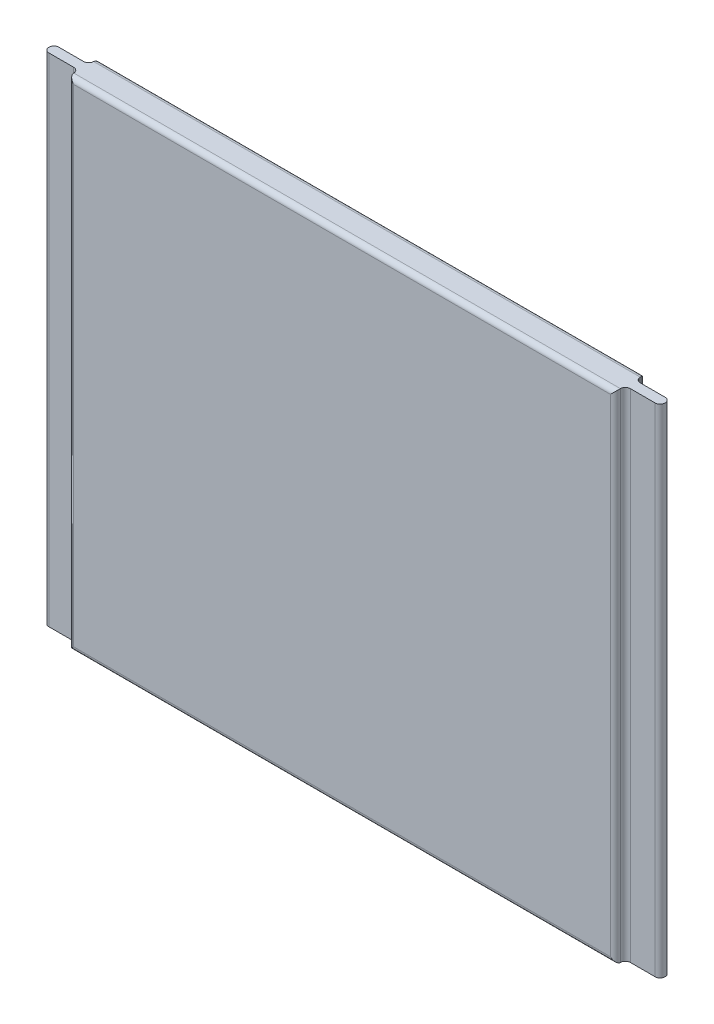
from build123d import *

# Parameters (mm, degrees)
BOSS_EXTRUDE1_DEPTH = 100
FILLET1_R           = 1


with BuildPart() as part:
    # Sketch2 → Boss-Extrude1 (new body)
    with BuildSketch(Plane(origin=(0, 0, 0), x_dir=(1, 0, 0), z_dir=(0, 1, 0))):
        with BuildLine():
            Line((-55, 3), (55, 3))
            Line((55, 3), (55, 2))
            ThreePointArc((55, 2), (55.292893219, 1.292893219), (56, 1))
            Line((56, 1), (61, 1))
            ThreePointArc((61, 1), (62, 0), (61, -1))
            Line((61, -1), (56, -1))
            ThreePointArc((56, -1), (55.292893219, -1.292893219), (55, -2))
            Line((55, -2), (55, -3))
            Line((55, -3), (-55, -3))
            Line((-55, -3), (-55, -2))
            ThreePointArc((-55, -2), (-55.292893219, -1.292893219), (-56, -1))
            Line((-56, -1), (-61, -1))
            ThreePointArc((-61, -1), (-62, 0), (-61, 1))
            Line((-61, 1), (-56, 1))
            ThreePointArc((-56, 1), (-55.292893219, 1.292893219), (-55, 2))
            Line((-55, 2), (-55, 3))
        make_face()
    extrude(amount=BOSS_EXTRUDE1_DEPTH)

    # Fillet1
    fillet1_edges = [part.edges().sort_by_distance(p)[0] for p in [
        (55, 50, -3),
        (0, 100, -3),
        (-55, 50, -3),
        (0, 0, -3),
        (-55, 50, 3),
        (0, 100, 3),
        (55, 50, 3),
        (0, 0, 3),
    ]]
    fillet(fillet1_edges, radius=FILLET1_R - 0.0001)  # a hair under: the kernel refuses the full size


solid = part.part
